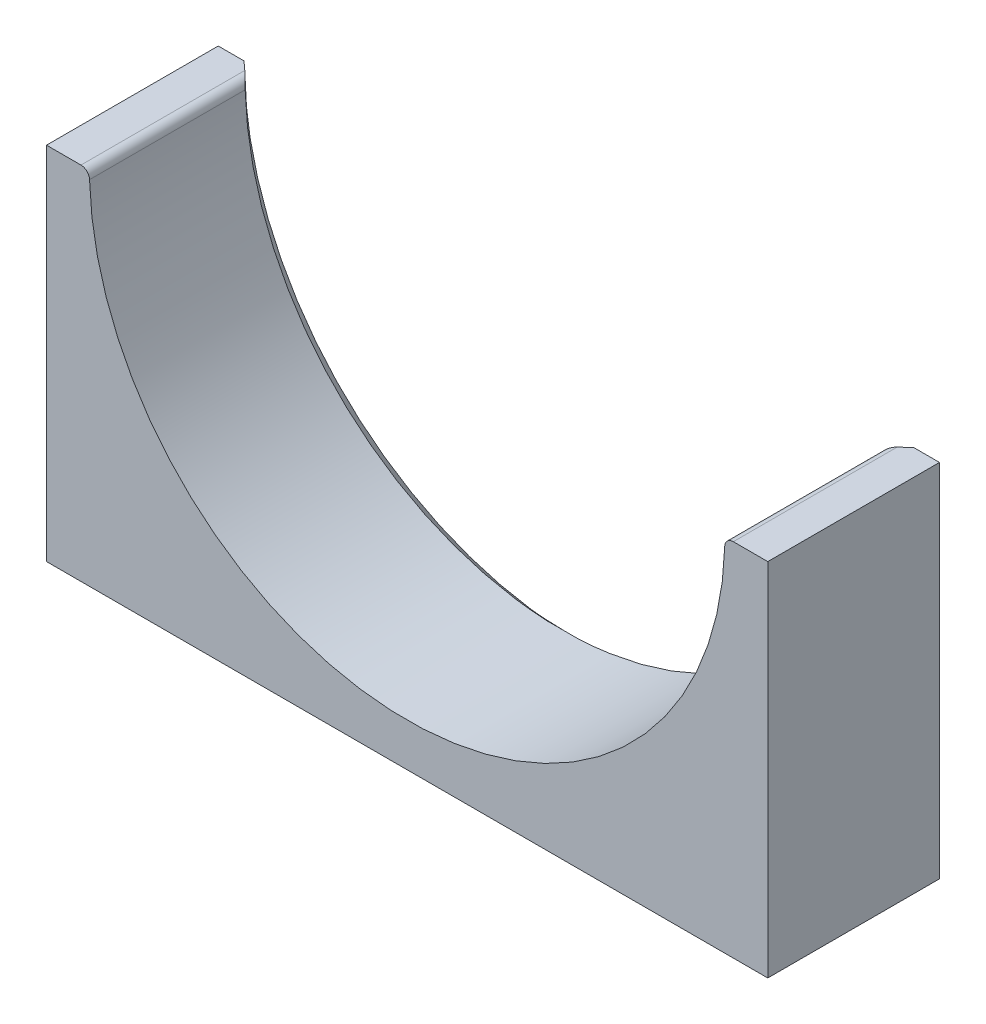
from build123d import *

# Parameters (mm, degrees)
SKETCH2_W           = 213.36
SKETCH2_H           = 213.36
SKETCH2_R           = 93.98
BOSS_EXTRUDE1_DEPTH = 50.8
SKETCH4_W           = 431.498092941
SKETCH4_H           = 427.351859682
CUT_EXTRUDE1_DEPTH  = 106.68
FILLET1_R           = 2.54


with BuildPart() as part:
    # Sketch2 → Boss-Extrude1 (new body)
    with BuildSketch(Plane.XY.offset(50.8)):
        Rectangle(SKETCH2_W, SKETCH2_H)
        Circle(SKETCH2_R, mode=Mode.SUBTRACT)
    extrude(amount=-BOSS_EXTRUDE1_DEPTH)

    # Cut-Loft1: read off the stored shape, not the designer's step
    # Cut-Loft1: loft between two sections, ruled curve by curve
    cut_loft1_from = [
        Edge.make_bspline([(-5.225836659, 98.922061398, 0), (-203.069959455, 88.47038808, 0), (-192.618286137, -109.373734716, 0), (5.225836659, -98.922061398, 0), (203.069959455, -88.47038808, 0), (192.618286137, 109.373734716, 0), (-5.225836659, 98.922061398, 0)], [0, 0, 0, 0, 0.5, 0.5, 0.5, 1, 1, 1, 1], 3, [1, 0.333333333, 0.333333333, 1, 0.333333333, 0.333333333, 1]),
    ]
    cut_loft1_to = [
        Edge.make_bspline([(82.069205503, 45.791766816, 50.8), (-9.514328128, 209.930177822, 50.8), (-173.652739134, 118.34664419, 50.8), (-82.069205503, -45.791766816, 50.8), (9.514328128, -209.930177822, 50.8), (173.652739134, -118.34664419, 50.8), (82.069205503, 45.791766816, 50.8)], [0, 0, 0, 0, 0.5, 0.5, 0.5, 1, 1, 1, 1], 3, [1, 0.333333333, 0.333333333, 1, 0.333333333, 0.333333333, 1]),
    ]
    cut_loft1 = Solid(Shell([*[Face.make_surface_from_curves(cut_loft1_from[k], cut_loft1_to[k]) for k in range(1)], Face(Wire(cut_loft1_from)), Face(Wire(cut_loft1_to))]))
    add(cut_loft1, mode=Mode.SUBTRACT)

    # Sketch4 → Cut-Extrude1 (cut)
    with BuildSketch(Plane(origin=(0, 106.68, 0), x_dir=(1, 0, 0), z_dir=(0, 1, 0))):
        with Locations((-43.743226098, -53.764043901)):
            Rectangle(SKETCH4_W, SKETCH4_H)
    extrude(amount=-CUT_EXTRUDE1_DEPTH, mode=Mode.SUBTRACT)

    # Fillet1
    fillet1_edges = [part.edges().sort_by_distance(p)[0] for p in [
        (93.98, 0, 27.785112978),
        (-93.98, 0, 27.785112678),
    ]]
    fillet(fillet1_edges, radius=FILLET1_R)


solid = part.part
